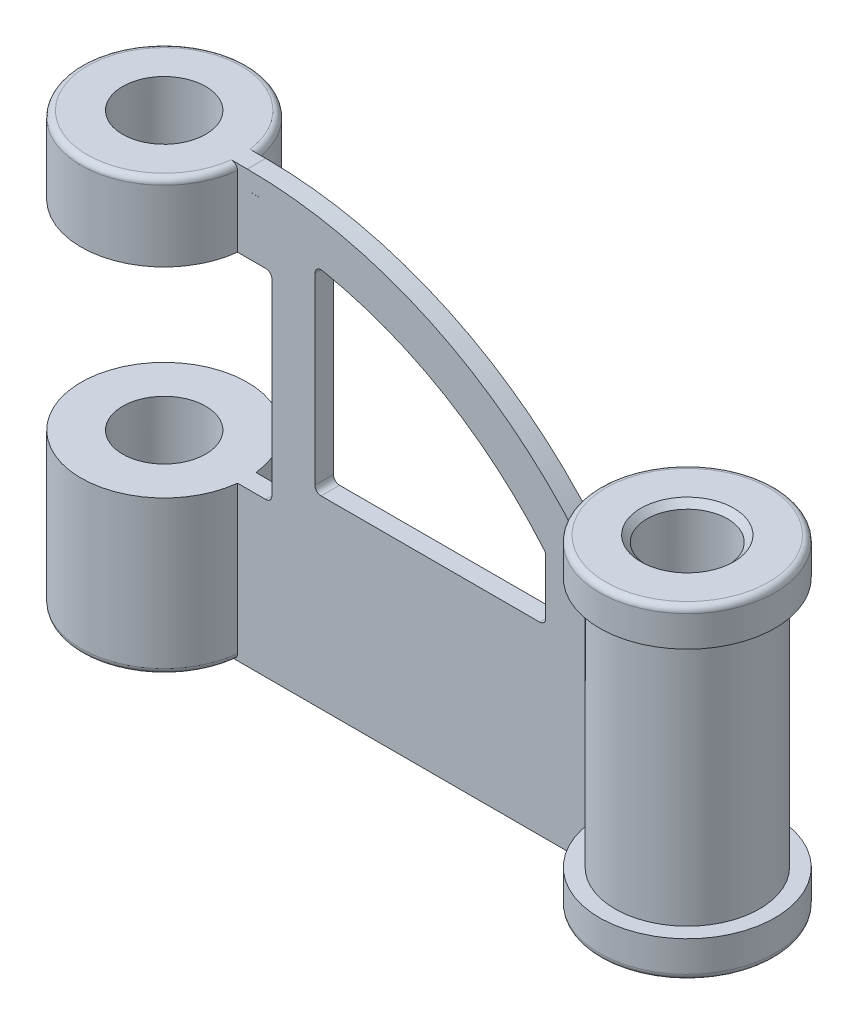
from build123d import *

# Parameters (mm, degrees)
SKETCH_13_W              = 5
SKETCH_13_H              = 81.5
EXTRUDE_1_DEPTH          = 3
EXTRUDE_1_DEPTH_BACK     = 3
EXTRUDE_2_DEPTH          = 3
EXTRUDE_2_DEPTH_BACK     = 3
SKETCH_2_R               = 13.5
SKETCH_2_R_2             = 13.100880905
CUT_EXTRUDE_7_DEPTH      = 183.935268761
CHAMFER_4_SIZE           = 2
CUT_EXTRUDE_9_DEPTH      = 183.935268761
CUT_EXTRUDE_9_DEPTH_BACK = 183.935268761


with BuildPart() as part:
    # Эскиз1 → Повернуть1 (revolve)
    with BuildSketch(Plane.XY):
        with BuildLine():
            Line((-84.25, 0), (-59.25, 0))
            ThreePointArc((-59.25, 0), (-57.835786438, 0.585786438), (-57.25, 2))
            Line((-57.25, 2), (-57.25, 138))
            ThreePointArc((-57.25, 138), (-57.835786438, 139.414213562), (-59.25, 140))
            Line((-59.25, 140), (-84.25, 140))
            Line((-84.25, 140), (-84.25, 0))
        make_face()
    revolve(axis=Axis((-84.25, 140, 0), (0, -1, 0)))



with BuildPart() as body_2:
    # Эскиз1<4> → Повернуть2 (revolve)
    with BuildSketch(Plane.XY):
        with BuildLine():
            ThreePointArc((57.25, 2), (57.835786438, 0.585786438), (59.25, 0))
            Line((59.25, 0), (85.75, 0))
            Line((85.75, 0), (85.75, 105.5))
            Line((85.75, 105.5), (59.25, 105.5))
            ThreePointArc((59.25, 105.5), (57.835786438, 104.914213562), (57.25, 103.5))
            Line((57.25, 103.5), (57.25, 2))
        make_face()
    revolve(axis=Axis((85.75, 105.5, 0), (0, -1, 0)))

    # Эскиз13 → Вырез-Повернуть2 (revolve, cut)
    with BuildSketch(Plane.XY):
        with Locations((59.75, 52.75)):
            Rectangle(SKETCH_13_W, SKETCH_13_H)
    revolve(axis=Axis((85.75, 105.5, 0), (0, -1, 0)), mode=Mode.SUBTRACT)


with BuildPart() as part_1:
    add(part.part)

    add(body_2.part)  # Бобышка-Вытянуть1 merges body 2
    # Эскиз1<5> → Бобышка-Вытянуть1 (add, two sides: drawn at the far end of the back side and taken through both)
    with BuildSketch(Plane.XY.offset(-EXTRUDE_1_DEPTH_BACK)):
        with BuildLine():
            Line((-54.25, 140), (-84.25, 140))
            Line((-84.25, 140), (-84.25, 0))
            Line((-84.25, 0), (-54.25, 0))
            Line((-54.25, 0), (85.75, 0))
            ThreePointArc((85.75, 0), (44.744949366, 98.994949366), (-54.25, 140))
        make_face()
        with BuildLine():
            ThreePointArc((-50.683198656, 133.952521171), (-52.466441333, 133.988129767), (-54.25, 134))
            Line((-54.25, 134), (-50.25, 134))
            ThreePointArc((-50.25, 134), (-50.467896371, 133.98809486), (-50.683198656, 133.952521171))
        make_face(mode=Mode.SUBTRACT)
    extrude(amount=EXTRUDE_1_DEPTH + EXTRUDE_1_DEPTH_BACK)

    # Эскиз1<6> → Бобышка-Вытянуть2 (add, two sides: drawn at the far end of the back side and taken through both)
    with BuildSketch(Plane.XY.offset(-EXTRUDE_2_DEPTH_BACK)):
        with BuildLine():
            ThreePointArc((50.310606061, 83.803816502), (5.345362261, 120.018301925), (-50.683198656, 133.952521171))
            ThreePointArc((-50.683198656, 133.952521171), (-51.809871359, 133.251719355), (-52.25, 132))
            Line((-52.25, 132), (-52.25, 8))
            ThreePointArc((-52.25, 8), (-51.664213562, 6.585786438), (-50.25, 6))
            Line((-50.25, 6), (48.75, 6))
            ThreePointArc((48.75, 6), (50.164213562, 6.585786438), (50.75, 8))
            Line((50.75, 8), (50.75, 82.55301327))
            ThreePointArc((50.75, 82.55301327), (50.636956825, 83.215881236), (50.310606061, 83.803816502))
        make_face()
    extrude(amount=EXTRUDE_2_DEPTH + EXTRUDE_2_DEPTH_BACK)

    # Эскиз2 → Вырез-Вытянуть7 (cut, through all)
    with BuildSketch(Plane(origin=(0, 0, 0), x_dir=(1, 0, 0), z_dir=(0, 1, 0))):
        with Locations((-84.25, 0)):
            Circle(SKETCH_2_R)
        with Locations((85.75, 0)):
            Circle(SKETCH_2_R_2)
    extrude(amount=CUT_EXTRUDE_7_DEPTH, mode=Mode.SUBTRACT)

    # Фаска4
    chamfer_4_edges = [part_1.edges().sort_by_distance(p)[0] for p in [
        (72.649119095, 105.5, 0),
        (72.649119095, 0, 0),
    ]]
    chamfer(chamfer_4_edges, length=CHAMFER_4_SIZE)

    # Эскиз5 → Вырез-Вытянуть9 (cut, two sides: drawn at the far end of the back side and taken through both)
    with BuildSketch(Plane.XY.offset(-CUT_EXTRUDE_9_DEPTH_BACK)):
        with BuildLine():
            Line((-111.25, 115), (-111.25, 50))
            Line((-111.25, 50), (-48.25, 50))
            ThreePointArc((-48.25, 50), (-46.835786438, 50.585786438), (-46.25, 52))
            Line((-46.25, 52), (-46.25, 113))
            ThreePointArc((-46.25, 113), (-46.835786438, 114.414213562), (-48.25, 115))
            Line((-48.25, 115), (-111.25, 115))
        make_face()
        with BuildLine():
            Line((42.75, 62), (42.75, 79.693161564))
            ThreePointArc((42.75, 79.693161564), (42.62943025, 80.377078178), (42.282258065, 80.978535137))
            ThreePointArc((42.282258065, 80.978535137), (9.858435299, 108.471694573), (-29.862903226, 123.617432067))
            ThreePointArc((-29.862903226, 123.617432067), (-31.52000127, 123.200273834), (-32.25, 121.655250606))
            Line((-32.25, 121.655250606), (-32.25, 62))
            ThreePointArc((-32.25, 62), (-31.664213562, 60.585786438), (-30.25, 60))
            Line((-30.25, 60), (40.75, 60))
            ThreePointArc((40.75, 60), (42.164213562, 60.585786438), (42.75, 62))
        make_face()
    extrude(amount=CUT_EXTRUDE_9_DEPTH + CUT_EXTRUDE_9_DEPTH_BACK, mode=Mode.SUBTRACT)


solid = part_1.part
